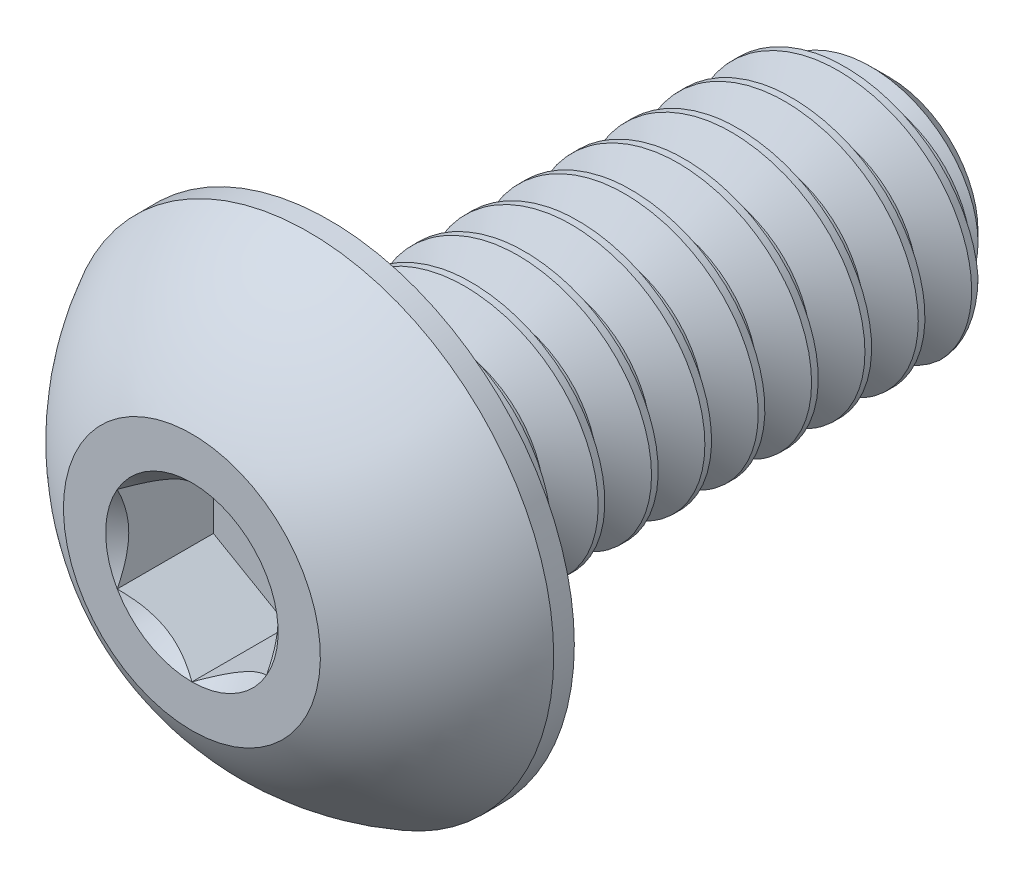
from build123d import *

# Parameters (mm, degrees)
SKETCH1_W          = 4.7625
SKETCH1_H          = 1.0922
CHAMFER1_SIZE      = 0.340178571
CUT_SWEEP1_PITCH   = 0.453571429
CUT_EXTRUDE2_DEPTH = 0.81788


with BuildPart() as part:
    # Sketch1 → Revolve1 (revolve)
    with BuildSketch(Plane(origin=(0, 0, 0), x_dir=(0, 0, -1), z_dir=(1, 0, 0))):
        with Locations((3.54965, 0.5461)):
            Rectangle(SKETCH1_W, SKETCH1_H)
    revolve(axis=Axis((0, 0, -5.9309), (0, 0, 1)))

    # Chamfer1
    chamfer1_edges = [part.edges().sort_by_distance(p)[0] for p in [
        (0, -1.0922, -5.9309),
    ]]
    chamfer(chamfer1_edges, length=CHAMFER1_SIZE)

    # Cut-Sweep1: the profile of Sketch2 profile screwed along a right-hand helix of 11.5 turns, 6 arcs to a turn; built about Z, then put on its axis
    cut_sweep1_z = Axis((0, 0, 0), (0, 0, 1))
    cut_sweep1_corners = [(1.0925, 0, 0.000173205), (1.0925, 0, -0.397048205), (0.797596715, 0, -0.226785714), (0.797596715, 0, -0.170089286)]
    with BuildLine(mode=Mode.PRIVATE) as cut_sweep1_profile:
        Line(cut_sweep1_corners[0], cut_sweep1_corners[1])
        Line(cut_sweep1_corners[1], cut_sweep1_corners[2])
        Line(cut_sweep1_corners[2], cut_sweep1_corners[3])
        Line(cut_sweep1_corners[3], cut_sweep1_corners[0])
    cut_sweep1_cap = Face(cut_sweep1_profile.wire())
    cut_sweep1_turn_angles = [0, 30, 60, 90, 120, 150, 180, 210, 240, 270, 300, 330, 360]
    cut_sweep1_turn_weights = [1, 0.8660254037844387, 1, 0.8660254037844387, 1, 0.8660254037844387, 1, 0.8660254037844387, 1, 0.8660254037844387, 1, 0.8660254037844387, 1]
    cut_sweep1_turn_rails = [Edge.make_bspline([Vector(p[0], p[1], 0).rotate(cut_sweep1_z, cut_sweep1_turn_angles[k]) / cut_sweep1_turn_weights[k] + Vector(0, 0, p[2] + CUT_SWEEP1_PITCH * cut_sweep1_turn_angles[k] / 360) for k in range(13)], [0, 0, 0, 1, 1, 2, 2, 3, 3, 4, 4, 5, 5, 6, 6, 6], 2, cut_sweep1_turn_weights) for p in cut_sweep1_corners]
    cut_sweep1_turn_sides = [Face.make_surface_from_curves(cut_sweep1_turn_rails[p[0]], cut_sweep1_turn_rails[p[1]]) for p in [(0, 1), (1, 2), (2, 3), (3, 0)]]
    cut_sweep1_last_angles = [3960, 3990, 4020, 4050, 4080, 4110, 4140]
    cut_sweep1_last_weights = [1, 0.8660254037844387, 1, 0.8660254037844387, 1, 0.8660254037844267, 1]
    cut_sweep1_last_rails = [Edge.make_bspline([Vector(p[0], p[1], 0).rotate(cut_sweep1_z, cut_sweep1_last_angles[k]) / cut_sweep1_last_weights[k] + Vector(0, 0, p[2] + CUT_SWEEP1_PITCH * cut_sweep1_last_angles[k] / 360) for k in range(7)], [0, 0, 0, 1, 1, 2, 2, 3, 3, 3], 2, cut_sweep1_last_weights) for p in cut_sweep1_corners]
    cut_sweep1_last_sides = [Face.make_surface_from_curves(cut_sweep1_last_rails[p[0]], cut_sweep1_last_rails[p[1]]) for p in [(0, 1), (1, 2), (2, 3), (3, 0)]]
    cut_sweep1 = Plane(origin=(0, 0, -5.9309), x_dir=(0, 1, 0), z_dir=(0, 0, 1)) * Solid(Shell([*[p.moved(Location((0, 0, CUT_SWEEP1_PITCH * i))) for i in range(11) for p in cut_sweep1_turn_sides], *cut_sweep1_last_sides, cut_sweep1_cap, cut_sweep1_cap.rotate(cut_sweep1_z, 4140).moved(Location((0, 0, CUT_SWEEP1_PITCH * 4140 / 360)))]))
    add(cut_sweep1, mode=Mode.SUBTRACT)

    # Sketch7 → Revolve2 (revolve)
    with BuildSketch(Plane(origin=(0, 0, 0), x_dir=(0, 0, -1), z_dir=(1, 0, 0)), mode=Mode.PRIVATE) as revolve2_sk:
        with BuildLine():
            Line((0.99314, 2.0828), (1.1684, 2.0828))
            Line((1.1684, 2.0828), (1.1684, 0))
            Line((1.1684, 0), (0, 0))
            Line((0, 0), (0, 1.0922))
            ThreePointArc((0, 1.0922), (0.420912553, 1.663351441), (0.99314, 2.0828))
        make_face()
    revolve(revolve2_sk.sketch.rotate(Axis((0, 0, 0), (0, 0, -1)), 189.336081704), axis=Axis((0, 0, 0), (0, 0, -1)))

    # Sketch5 → Cut-Extrude2 (cut)
    with BuildSketch(Plane.XY):
        Polygon((0.635, -0.366617421), (0.635, 0.366617421), (0, 0.733234842), (-0.635, 0.366617421), (-0.635, -0.366617421), (0, -0.733234842), align=None)
    extrude(amount=-CUT_EXTRUDE2_DEPTH, mode=Mode.SUBTRACT)

    # Cut-Extrude3 cone 1 section (through the dimple's axis) → Cut-Extrude3 (revolve, cut)
    with BuildSketch(Plane(origin=(0, 0, 0), x_dir=(0, -1, 0), z_dir=(1, 0, 0))):
        Polygon((0, 0), (0.733234842, 0), (0, 0.733234842), align=None)
    revolve(axis=Axis((0, 0, 0), (0, 0, -1)), mode=Mode.SUBTRACT)


solid = part.part
